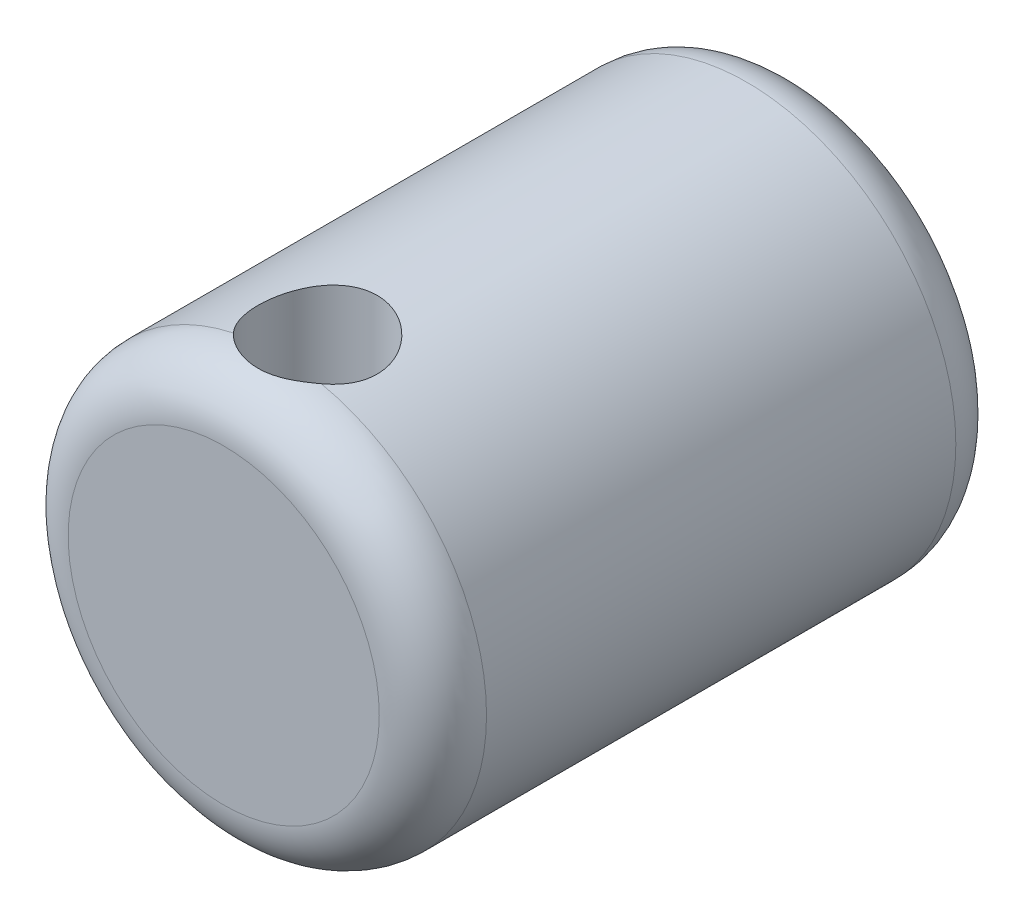
from build123d import *

# Parameters (mm, degrees)
SKETCH2_R                           = 4.953
SKETCH2_R_2                         = 2.413
BOSS_EXTRUDE1_DEPTH                 = 8.89
BOSS_EXTRUDE2_START                 = 4.7625
SKETCH2_2_R                         = 4.953
SKETCH2_2_R_2                       = 2.413
SKETCH2_2_R_3                       = 1.9939
BOSS_EXTRUDE2_DEPTH                 = 4.7625
CUT_EXTRUDE1_REACH                  = 13.318
CUT_EXTRUDE1_END_RADIUS             = 4.953
SKETCH8_R                           = 1.411111111
CUT_EXTRUDE1_DIRECTION_2_REACH      = 13.318
CUT_EXTRUDE1_DIRECTION_2_END_RADIUS = 4.953
FILLET2_R                           = 1.27


with BuildPart() as part:
    # Sketch2 → Boss-Extrude1 (new body)
    with BuildSketch(Plane.XY):
        Circle(SKETCH2_R)
        Circle(SKETCH2_R_2, mode=Mode.SUBTRACT)
    extrude(amount=-BOSS_EXTRUDE1_DEPTH)

    # Sketch2<2> → Boss-Extrude2 (add)
    # profile 1 of 3: a face of its own
    with BuildSketch(Plane.XY.offset(BOSS_EXTRUDE2_START)):
        Circle(SKETCH2_2_R)
        Circle(SKETCH2_2_R_2, mode=Mode.SUBTRACT)
    # profile 2 of 3: a face of its own
    with BuildSketch(Plane.XY.offset(BOSS_EXTRUDE2_START)):
        Circle(SKETCH2_2_R_2)
        Circle(SKETCH2_2_R_3, mode=Mode.SUBTRACT)
    # profile 3 of 3: a face of its own
    with BuildSketch(Plane.XY.offset(BOSS_EXTRUDE2_START)):
        Circle(SKETCH2_2_R_3)
    extrude(amount=-BOSS_EXTRUDE2_DEPTH)

    # Cut-Extrude1: up to this cylinder (the profile starts inside it)
    cut_extrude1_end = Plane(origin=(0, 0, 2.54), z_dir=(0, 0, 1)) * Cylinder(CUT_EXTRUDE1_END_RADIUS, 37.542, mode=Mode.PRIVATE)
    # Sketch8 → Cut-Extrude1 (cut, up to the surface)
    with BuildSketch(Plane(origin=(0, 0, 0), x_dir=(1, 0, 0), z_dir=(0, 1, 0)), mode=Mode.PRIVATE) as cut_extrude1_sk1:
        with Locations(Location((0, -2.54, 0), (0, 0, 90))):
            Circle(SKETCH8_R)
    cut_extrude1_tool1 = extrude(cut_extrude1_sk1.sketch, amount=-CUT_EXTRUDE1_REACH, mode=Mode.PRIVATE) & cut_extrude1_end
    add(cut_extrude1_tool1.solids().sort_by_distance((0, 0, 2.54))[0], mode=Mode.SUBTRACT)

    # Cut-Extrude1 direction 2: up to this cylinder (the profile starts inside it)
    cut_extrude1_direction_2_end = Plane(origin=(0, 0, 2.54), z_dir=(0, 0, 1)) * Cylinder(CUT_EXTRUDE1_DIRECTION_2_END_RADIUS, 37.542, mode=Mode.PRIVATE)
    # Sketch8 → Cut-Extrude1 direction 2 (cut, up to the surface)
    with BuildSketch(Plane(origin=(0, 0, 0), x_dir=(1, 0, 0), z_dir=(0, 1, 0)), mode=Mode.PRIVATE) as cut_extrude1_direction_2_sk1:
        with Locations(Location((0, -2.54, 0), (0, 0, 90))):
            Circle(SKETCH8_R)
    cut_extrude1_direction_2_tool1 = extrude(cut_extrude1_direction_2_sk1.sketch, amount=CUT_EXTRUDE1_DIRECTION_2_REACH, mode=Mode.PRIVATE) & cut_extrude1_direction_2_end
    add(cut_extrude1_direction_2_tool1.solids().sort_by_distance((0, 0, 2.54))[0], mode=Mode.SUBTRACT)

    # Fillet2
    # the kernel refuses this fillet: 1.27 mm, written as the material it takes off along each edge
    with BuildSketch(Plane(origin=(0, 0, -8.89), x_dir=(1, 0, 0), z_dir=(0, -1, 0))) as fillet2_piece_1:
        with BuildLine():
            CenterArc((4.953 - FILLET2_R, FILLET2_R), FILLET2_R, 270, 90)
            Line((4.953 - FILLET2_R, 0), (4.953, 0))
            Line((4.953, 0), (4.953, FILLET2_R))
        make_face()
    revolve(axis=Axis((0, 0, -8.89), (0, 0, 1)), mode=Mode.SUBTRACT)
    with BuildSketch(Plane(origin=(0, 0, 4.7625), x_dir=(1, 0, 0), z_dir=(0, -1, 0))) as fillet2_piece_2:
        with BuildLine():
            CenterArc((4.953 - FILLET2_R, -FILLET2_R), FILLET2_R, 0, 90)
            Line((4.953 - FILLET2_R, 0), (4.953, 0))
            Line((4.953, 0), (4.953, -FILLET2_R))
        make_face()
    revolve(axis=Axis((0, 0, 4.7625), (0, 0, 1)), mode=Mode.SUBTRACT)


solid = part.part
